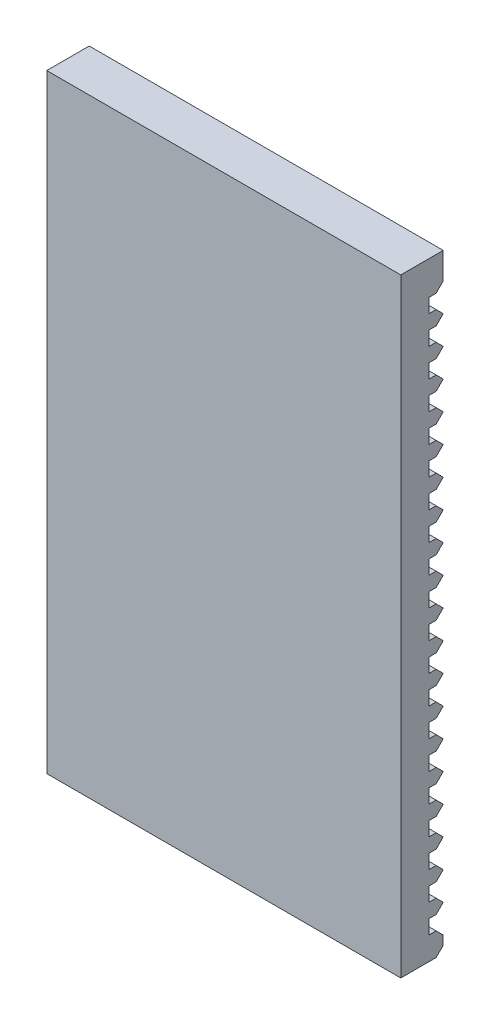
from build123d import *

# Parameters (mm, degrees)
ESBO_O1_W                = 2.5
ESBO_O1_H                = 4.3
RESSALTO_EXTRUS_O1_DEPTH = 0.3
ESBO_O2_W                = 2.5
ESBO_O2_H                = 0.1
CORTE_EXTRUS_O1_DEPTH    = 0.1
CHANFRO1_SIZE            = 0.05


with BuildPart() as part:
    # Esboço1 → Ressalto-extrusão1 (new body)
    with BuildSketch(Plane.XY):
        with Locations((-3.764526375, -0.853246753)):
            Rectangle(ESBO_O1_W, ESBO_O1_H)
    extrude(amount=RESSALTO_EXTRUS_O1_DEPTH)

    # Esboço2 → Corte-extrusão1 (cut)
    with BuildSketch(Plane(origin=(0, 0, 0), x_dir=(-1, 0, 0), z_dir=(0, 0, -1))):
        with Locations((3.764526375, 0.809857643)):
            Rectangle(ESBO_O2_W, ESBO_O2_H)
        with Locations((3.764526375, 1.009857643)):
            Rectangle(ESBO_O2_W, ESBO_O2_H)
        with Locations((3.764526375, 0.609857643)):
            Rectangle(ESBO_O2_W, ESBO_O2_H)
        with Locations((3.764526375, 0.409857643)):
            Rectangle(ESBO_O2_W, ESBO_O2_H)
        with Locations((3.764526375, 0.209857643)):
            Rectangle(ESBO_O2_W, ESBO_O2_H)
        with Locations((3.764526375, 0.009857643)):
            Rectangle(ESBO_O2_W, ESBO_O2_H)
        with Locations((3.764526375, -0.190142357)):
            Rectangle(ESBO_O2_W, ESBO_O2_H)
        with Locations((3.764526375, -0.390142357)):
            Rectangle(ESBO_O2_W, ESBO_O2_H)
        with Locations((3.764526375, -0.590142357)):
            Rectangle(ESBO_O2_W, ESBO_O2_H)
        with Locations((3.764526375, -0.790142357)):
            Rectangle(ESBO_O2_W, ESBO_O2_H)
        with Locations((3.764526375, -0.990142357)):
            Rectangle(ESBO_O2_W, ESBO_O2_H)
        with Locations((3.764526375, -1.190142357)):
            Rectangle(ESBO_O2_W, ESBO_O2_H)
        with Locations((3.764526375, -1.390142357)):
            Rectangle(ESBO_O2_W, ESBO_O2_H)
        with Locations((3.764526375, -1.590142357)):
            Rectangle(ESBO_O2_W, ESBO_O2_H)
        with Locations((3.764526375, -1.790142357)):
            Rectangle(ESBO_O2_W, ESBO_O2_H)
        with Locations((3.764526375, -1.990142357)):
            Rectangle(ESBO_O2_W, ESBO_O2_H)
        with Locations((3.764526375, -2.190142357)):
            Rectangle(ESBO_O2_W, ESBO_O2_H)
        with Locations((3.764526375, -2.390142357)):
            Rectangle(ESBO_O2_W, ESBO_O2_H)
        with Locations((3.764526375, -2.590142357)):
            Rectangle(ESBO_O2_W, ESBO_O2_H)
        with Locations((3.764526375, -2.790142357)):
            Rectangle(ESBO_O2_W, ESBO_O2_H)
    extrude(amount=-CORTE_EXTRUS_O1_DEPTH, mode=Mode.SUBTRACT)

    # Chanfro1
    # the kernel refuses this chamfer: 0.05 mm, written as the material it takes off along each edge
    with BuildSketch(Plane(origin=(-5.143110525, -0.240142357, 0), x_dir=(0, -0.9996219169112968, -0.027495876610586355), z_dir=(1, 0, 0)), Plane(origin=(-5.143110525, -0.440142357, 0), x_dir=(0, -0.9996219169112968, -0.027495876610586386), z_dir=(1, 0, 0)), Plane(origin=(-5.143110525, -0.640142357, 0), x_dir=(0, -0.9996219169112968, -0.027495876610586313), z_dir=(1, 0, 0)), Plane(origin=(-5.143110525, -0.840142357, 0), x_dir=(0, -0.9996219169112968, -0.027495876610586313), z_dir=(1, 0, 0)), Plane(origin=(-5.143110525, -1.040142357, 0), x_dir=(0, -0.9996219169112968, -0.027495876610586313), z_dir=(1, 0, 0)), Plane(origin=(-5.143110525, -1.240142357, 0), x_dir=(0, -0.9996219169112968, -0.027495876610586313), z_dir=(1, 0, 0)), Plane(origin=(-5.143110525, -1.440142357, 0), x_dir=(0, -0.9996219169112968, -0.027495876610586313), z_dir=(1, 0, 0)), Plane(origin=(-5.143110525, -1.640142357, 0), x_dir=(0, -0.9996219169112968, -0.027495876610586313), z_dir=(1, 0, 0)), Plane(origin=(-5.143110525, 0.959857643, 0), x_dir=(0, -0.9996219169112968, -0.027495876610586344), z_dir=(1, 0, 0)), Plane(origin=(-2.385942226, 1.059857643, 0), x_dir=(0, 0.9996219169112968, -0.027495876610586313), z_dir=(-1, 0, 0)), Plane(origin=(-5.143110525, -1.840142357, 0), x_dir=(0, -0.9996219169112968, -0.027495876610586313), z_dir=(1, 0, 0)), Plane(origin=(-5.143110525, -2.040142357, 0), x_dir=(0, -0.9996219169112966, -0.027495876610586487), z_dir=(1, 0, 0)), Plane(origin=(-5.143110525, -2.240142357, 0), x_dir=(0, -0.9996219169112966, -0.027495876610586487), z_dir=(1, 0, 0)), Plane(origin=(-5.143110525, -2.440142357, 0), x_dir=(0, -0.9996219169112966, -0.027495876610586487), z_dir=(1, 0, 0)), Plane(origin=(-5.143110525, -2.640142357, 0), x_dir=(0, -0.9996219169112966, -0.027495876610586487), z_dir=(1, 0, 0)), Plane(origin=(-5.143110525, -2.840142357, 0), x_dir=(0, -0.9996219169112966, -0.027495876610586487), z_dir=(1, 0, 0)), Plane(origin=(-5.143110525, 0.759857643, 0), x_dir=(0, -0.9996219169112968, -0.02749587661058628), z_dir=(1, 0, 0)), Plane(origin=(-5.143110525, 0.559857643, 0), x_dir=(0, -0.9996219169112968, -0.027495876610586313), z_dir=(1, 0, 0)), Plane(origin=(-2.385942226, -3.003246753, 0), x_dir=(0, 0.9996219169112966, -0.027495876610586487), z_dir=(-1, 0, 0)), Plane(origin=(-5.143110525, 0.359857643, 0), x_dir=(0, -0.9996219169112968, -0.027495876610586355), z_dir=(1, 0, 0)), Plane(origin=(-5.143110525, 0.159857643, 0), x_dir=(0, -0.9996219169112968, -0.027495876610586303), z_dir=(1, 0, 0)), Plane(origin=(-5.143110525, -0.040142357, 0), x_dir=(0, -0.9996219169112968, -0.02749587661058635), z_dir=(1, 0, 0))) as chanfro1_piece_1:
        Polygon((CHANFRO1_SIZE * 0.999621916911, -CHANFRO1_SIZE * 0.0274958766106), (-CHANFRO1_SIZE * 0.0274958766106, -CHANFRO1_SIZE * 0.999621916911), (0, 0), align=None)
    extrude(amount=2.757168299, mode=Mode.SUBTRACT)
    with BuildSketch(Plane(origin=(-2.385942226, -0.140142357, 0), x_dir=(0, -0.027495876610586275, 0.9996219169112968), z_dir=(-1, 0, 0)), Plane(origin=(-2.385942226, -0.340142357, 0), x_dir=(0, -0.027495876610586275, 0.9996219169112968), z_dir=(-1, 0, 0)), Plane(origin=(-2.385942226, -0.540142357, 0), x_dir=(0, -0.02749587661058735, 0.9996219169112966), z_dir=(-1, 0, 0)), Plane(origin=(-2.385942226, -0.740142357, 0), x_dir=(0, -0.02749587661058735, 0.9996219169112966), z_dir=(-1, 0, 0)), Plane(origin=(-2.385942226, -0.940142357, 0), x_dir=(0, -0.02749587661058735, 0.9996219169112966), z_dir=(-1, 0, 0)), Plane(origin=(-2.385942226, -1.140142357, 0), x_dir=(0, -0.02749587661058735, 0.9996219169112966), z_dir=(-1, 0, 0)), Plane(origin=(-2.385942226, -1.340142357, 0), x_dir=(0, -0.02749587661058735, 0.9996219169112966), z_dir=(-1, 0, 0)), Plane(origin=(-2.385942226, -1.540142357, 0), x_dir=(0, -0.02749587661058735, 0.9996219169112966), z_dir=(-1, 0, 0)), Plane(origin=(-2.385942226, -1.740142357, 0), x_dir=(0, -0.02749587661058735, 0.9996219169112966), z_dir=(-1, 0, 0)), Plane(origin=(-2.385942226, -1.940142357, 0), x_dir=(0, -0.02749587661058735, 0.9996219169112966), z_dir=(-1, 0, 0)), Plane(origin=(-2.385942226, -2.140142357, 0), x_dir=(0, -0.02749587661058735, 0.9996219169112966), z_dir=(-1, 0, 0)), Plane(origin=(-2.385942226, -2.340142357, 0), x_dir=(0, -0.02749587661058735, 0.9996219169112966), z_dir=(-1, 0, 0)), Plane(origin=(-2.385942226, -2.540142357, 0), x_dir=(0, -0.02749587661058735, 0.9996219169112966), z_dir=(-1, 0, 0)), Plane(origin=(-2.385942226, -2.740142357, 0), x_dir=(0, -0.02749587661058735, 0.9996219169112966), z_dir=(-1, 0, 0)), Plane(origin=(-2.385942226, 0.859857643, 0), x_dir=(0, -0.02749587661058735, 0.9996219169112966), z_dir=(-1, 0, 0)), Plane(origin=(-2.385942226, 0.659857643, 0), x_dir=(0, -0.027495876610587354, 0.9996219169112966), z_dir=(-1, 0, 0)), Plane(origin=(-2.385942226, 0.459857643, 0), x_dir=(0, -0.027495876610586275, 0.9996219169112968), z_dir=(-1, 0, 0)), Plane(origin=(-2.385942226, 0.259857643, 0), x_dir=(0, -0.027495876610586275, 0.9996219169112968), z_dir=(-1, 0, 0)), Plane(origin=(-2.385942226, 0.059857643, 0), x_dir=(0, -0.027495876610586407, 0.9996219169112968), z_dir=(-1, 0, 0))) as chanfro1_piece_2:
        Polygon((CHANFRO1_SIZE * 0.999621916911, CHANFRO1_SIZE * 0.0274958766106), (-CHANFRO1_SIZE * 0.0274958766106, CHANFRO1_SIZE * 0.999621916911), (0, 0), align=None)
    extrude(amount=2.757168299, mode=Mode.SUBTRACT)


solid = part.part
